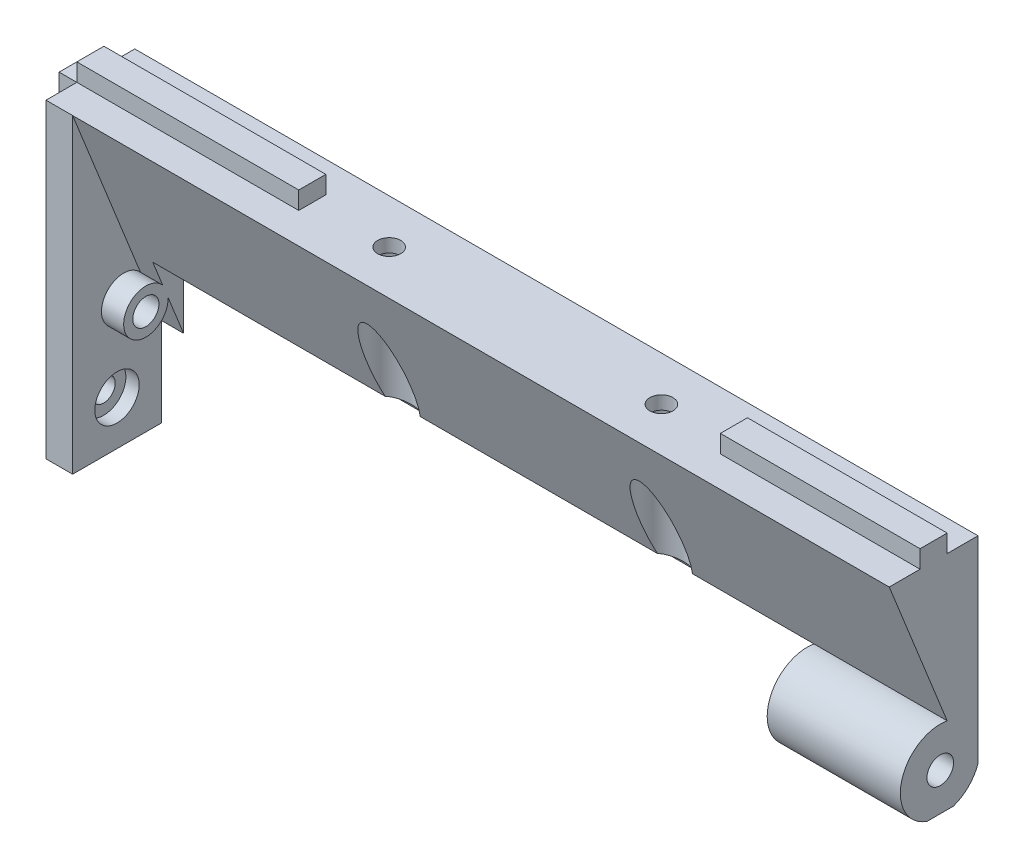
from build123d import *
from build123d.topology import SkipClean

# Parameters (mm, degrees)
SKETCH_1_W           = 120
SKETCH_1_H           = 20
EXTRUDE_1_DEPTH      = 50
SKETCH_2_W           = 6
SKETCH_2_H           = 20
EXTRUDE_2_DEPTH      = 20
CUT_EXTRUDE_1_DEPTH  = 114
SKETCH_4_R           = 2.6
SKETCH_4_W           = 20
SKETCH_4_H           = 20
CUT_EXTRUDE_2_DEPTH  = 114
SKETCH_5_R           = 5
CUT_EXTRUDE_3_DEPTH  = 3
SKETCH_9_R           = 5
SKETCH_9_R_2         = 2.6
EXTRUDE_3_DEPTH      = 3
SKETCH_11_R          = 5
EXTRUDE_4_DEPTH      = 6
CUT_EXTRUDE_6_DEPTH  = 6
CUT_EXTRUDE_8_DEPTH  = 109
SKETCH_14_W          = 20
SKETCH_14_H          = 20
SKETCH_14_R          = 2.6
EXTRUDE_5_DEPTH      = 6
SKETCH_15_R          = 5
CUT_EXTRUDE_9_DEPTH  = 3
SKETCH_18_R          = 5
SKETCH_18_R_2        = 3
EXTRUDE_6_DEPTH      = 5
SKETCH_19_R          = 3
SKETCH_19_R_2        = 2.95
EXTRUDE_7_DEPTH      = 11
EXTRUDE_START        = 70
EXTRUDE_8_DEPTH      = 70
SKETCH_22_W          = 6.1
SKETCH_22_H          = 38.55
EXTRUDE_9_DEPTH      = 4
SKETCH_24_W          = 30
SKETCH_24_H          = 20
EXTRUDE_10_DEPTH     = 50
SKETCH_25_R          = 2.95
CUT_EXTRUDE_10_DEPTH = 200
SKETCH_30_R          = 5
SKETCH_30_R_2        = 2.6
EXTRUDE_11_DEPTH     = 3
SKETCH_32_R          = 3
CUT_EXTRUDE_12_DEPTH = 30
CUT_EXTRUDE_START    = -30
CUT_EXTRUDE_13_DEPTH = 30
SKETCH_35_R          = 5
CUT_EXTRUDE_14_DEPTH = 60
SKETCH_36_R          = 5
SKETCH_36_R_2        = 2.6
EXTRUDE_12_DEPTH     = 3
SKETCH_37_W          = 45
SKETCH_37_H          = 6.104076207
SKETCH_37_W_2        = 50
SKETCH_37_H_2        = 6.1
EXTRUDE_13_DEPTH     = 4


with BuildPart() as part:
    # 草图1 → 凸台-拉伸1 (new body)
    with BuildSketch(Plane(origin=(0, 0, 0), x_dir=(1, 0, 0), z_dir=(0, 1, 0))):
        with Locations((60, 10)):
            Rectangle(SKETCH_1_W, SKETCH_1_H)
    extrude(amount=EXTRUDE_1_DEPTH)

    # 草图2 → 凸台-拉伸2 (add)
    with BuildSketch(Plane.XY):
        with Locations((3, -10)):
            Rectangle(SKETCH_2_W, SKETCH_2_H)
    extrude(amount=-EXTRUDE_2_DEPTH)

    # 草图3 → 切除-拉伸1 (cut)
    with BuildSketch(Plane(origin=(120, 0, 0), x_dir=(0, 0, -1), z_dir=(1, 0, 0))):
        Polygon((0, 50), (20, 0), (0, 0), align=None)
    extrude(amount=-CUT_EXTRUDE_1_DEPTH, mode=Mode.SUBTRACT)

    # 草图4 → 切除-拉伸2 (cut)
    with BuildSketch(Plane(origin=(6, 0, 0), x_dir=(0, 0, -1), z_dir=(1, 0, 0))):
        with Locations((10, 10)):
            Circle(SKETCH_4_R)
        with Locations((10, -10)):
            Rectangle(SKETCH_4_W, SKETCH_4_H)
    extrude(amount=-CUT_EXTRUDE_2_DEPTH, mode=Mode.SUBTRACT)

    # 草图5 → 切除-拉伸3 (cut)
    with BuildSketch(Plane(origin=(6, 0, 0), x_dir=(0, 0, -1), z_dir=(1, 0, 0))):
        with Locations((10, 10)):
            Circle(SKETCH_5_R)
    extrude(amount=-CUT_EXTRUDE_3_DEPTH, mode=Mode.SUBTRACT)

    # 草图9 → 凸台-拉伸3 (add)
    with BuildSketch(Plane(origin=(0, 50, 0), x_dir=(1, 0, 0), z_dir=(0, 1, 0))):
        with Locations((60, 10)):
            Circle(SKETCH_9_R)
        with Locations((60, 10)):
            Circle(SKETCH_9_R_2, mode=Mode.SUBTRACT)
    extrude(amount=-EXTRUDE_3_DEPTH)

    # 草图11 → 凸台-拉伸4 (add)
    with BuildSketch(Plane(origin=(6, 0, 0), x_dir=(0, 0, -1), z_dir=(1, 0, 0))):
        with Locations((10, 10)):
            Circle(SKETCH_11_R)
    extrude(amount=-EXTRUDE_4_DEPTH)

    # 草图12 → 切除-拉伸6 (cut)
    with BuildSketch(Plane.ZY):
        with BuildLine():
            ThreePointArc((-11.5, 5.5), (-9.378679656, 6.378679656), (-8.5, 8.5))
            ThreePointArc((-8.5, 8.5), (-13.621320344, 10.621320344), (-11.5, 5.5))
        make_face()
    extrude(amount=-CUT_EXTRUDE_6_DEPTH, mode=Mode.SUBTRACT)

    # 草图13 → 切除-拉伸8 (cut)
    with BuildSketch(Plane(origin=(120, 0, 0), x_dir=(0, 0, -1), z_dir=(1, 0, 0))):
        with BuildLine():
            Line((20, 0), (20, 11.458039892))
            ThreePointArc((20, 11.458039892), (17.330402546, 15.356121801), (13.054076207, 17.364809481))
            Line((13.054076207, 17.364809481), (20, 0))
        make_face()
    extrude(amount=-CUT_EXTRUDE_8_DEPTH, mode=Mode.SUBTRACT)

    # 草图14 → 凸台-拉伸5 (add)
    with BuildSketch(Plane.ZY):
        with Locations((-10, -10)):
            Rectangle(SKETCH_14_W, SKETCH_14_H)
        with Locations((-10, -10)):
            Circle(SKETCH_14_R, mode=Mode.SUBTRACT)
    extrude(amount=-EXTRUDE_5_DEPTH)

    # 草图15 → 切除-拉伸9 (cut)
    with BuildSketch(Plane(origin=(6, 0, 0), x_dir=(0, 0, -1), z_dir=(1, 0, 0))):
        with Locations((10, -10)):
            Circle(SKETCH_15_R)
    extrude(amount=-CUT_EXTRUDE_9_DEPTH, mode=Mode.SUBTRACT)

    # 草图18 → 凸台-拉伸6 (add)
    with SkipClean():  # the faces are left unmerged after this step: merging them gives an invalid solid
        with BuildSketch(Plane(origin=(6, 0, 0), x_dir=(0, 0, -1), z_dir=(1, 0, 0))):
            with Locations((11.5, 8.5)):
                Circle(SKETCH_18_R)
            with Locations((11.5, 8.5)):
                Circle(SKETCH_18_R_2, mode=Mode.SUBTRACT)
        extrude(amount=EXTRUDE_6_DEPTH)

    # 草图19 → 凸台-拉伸7 (add)
    with BuildSketch(Plane.ZY):
        with Locations((-11.5, 8.5)):
            Circle(SKETCH_19_R)
        with Locations((-11.5, 8.5)):
            Circle(SKETCH_19_R_2, mode=Mode.SUBTRACT)
    extrude(amount=-EXTRUDE_7_DEPTH)

    # 草图20 → 凸台-拉伸8 (add)
    with BuildSketch(Plane(origin=(120, 0, 0), x_dir=(0, 0, -1), z_dir=(1, 0, 0)).offset(EXTRUDE_START)):
        with BuildLine():
            Line((0, 50), (20, 50))
            Line((20, 50), (20, 11.458039892))
            ThreePointArc((20, 11.458039892), (17.330402546, 15.356121801), (13.054076207, 17.364809481))
            Line((13.054076207, 17.364809481), (0, 50))
        make_face()
    extrude(amount=-EXTRUDE_8_DEPTH)

    # 草图22 → 凸台-拉伸9 (add)
    with BuildSketch(Plane.ZY):
        with Locations((-10, 30.725)):
            Rectangle(SKETCH_22_W, SKETCH_22_H)
    extrude(amount=EXTRUDE_9_DEPTH)

    # 草图24 → 凸台-拉伸10 (add)
    with BuildSketch(Plane(origin=(0, 50, 0), x_dir=(1, 0, 0), z_dir=(0, 1, 0))):
        with Locations((175, 10)):
            Rectangle(SKETCH_24_W, SKETCH_24_H)
    extrude(amount=-EXTRUDE_10_DEPTH)

    # 草图25 → 切除-拉伸10 (cut)
    with BuildSketch(Plane.ZY):
        with Locations((-11.5, 8.5)):
            Circle(SKETCH_25_R)
    extrude(amount=-CUT_EXTRUDE_10_DEPTH, mode=Mode.SUBTRACT)

    # 草图30 → 凸台-拉伸11 (add)
    # profile 1 of 2: a face of its own
    with BuildSketch(Plane(origin=(0, 50, 0), x_dir=(1, 0, 0), z_dir=(0, 1, 0))):
        with Locations((57.33, 10)):
            Circle(SKETCH_30_R)
        with Locations((57.33, 10)):
            Circle(SKETCH_30_R_2, mode=Mode.SUBTRACT)
    # profile 2 of 2: a face of its own
    with BuildSketch(Plane(origin=(0, 50, 0), x_dir=(1, 0, 0), z_dir=(0, 1, 0))):
        with Locations((108.67, 10)):
            Circle(SKETCH_30_R)
        with Locations((108.67, 10)):
            Circle(SKETCH_30_R_2, mode=Mode.SUBTRACT)
    extrude(amount=-EXTRUDE_11_DEPTH)

    # 草图32 → 切除-拉伸12 (cut)
    with BuildSketch(Plane(origin=(190, 0, 0), x_dir=(0, 0, -1), z_dir=(1, 0, 0))):
        with Locations((11.5, 8.5)):
            Circle(SKETCH_32_R)
    extrude(amount=-CUT_EXTRUDE_12_DEPTH, mode=Mode.SUBTRACT)

    # 草图34 → 切除-拉伸13 (cut)
    with BuildSketch(Plane.ZY.offset(-160).offset(CUT_EXTRUDE_START)):
        with BuildLine():
            Line((0, 0), (0, 50))
            Line((0, 50), (-13.054076207, 17.364809481))
            ThreePointArc((-13.054076207, 17.364809481), (-2.789263488, 10.763419849), (-8.541960108, 0))
            Line((-8.541960108, 0), (0, 0))
        make_face()
        with BuildLine():
            ThreePointArc((-14.458039892, 0), (-17.863961031, 2.136038969), (-20, 5.541960108))
            Line((-20, 5.541960108), (-20, 0))
            Line((-20, 0), (-14.458039892, 0))
        make_face()
    extrude(amount=CUT_EXTRUDE_13_DEPTH, mode=Mode.SUBTRACT)

    # 草图35 → 切除-拉伸14 (cut)
    with BuildSketch(Plane(origin=(0, 50, 0), x_dir=(1, 0, 0), z_dir=(0, 1, 0))):
        with Locations((128.67, 10)):
            Circle(SKETCH_35_R)
        with Locations((67.33, 10)):
            Circle(SKETCH_35_R)
    extrude(amount=-CUT_EXTRUDE_14_DEPTH, mode=Mode.SUBTRACT)

    # 草图36 → 凸台-拉伸12 (add)
    # profile 1 of 2: a face of its own
    with BuildSketch(Plane(origin=(0, 50, 0), x_dir=(1, 0, 0), z_dir=(0, 1, 0))):
        with Locations((67.33, 10)):
            Circle(SKETCH_36_R)
        with Locations((67.33, 10)):
            Circle(SKETCH_36_R_2, mode=Mode.SUBTRACT)
    # profile 2 of 2: a face of its own
    with BuildSketch(Plane(origin=(0, 50, 0), x_dir=(1, 0, 0), z_dir=(0, 1, 0))):
        with Locations((128.67, 10)):
            Circle(SKETCH_36_R)
        with Locations((128.67, 10)):
            Circle(SKETCH_36_R_2, mode=Mode.SUBTRACT)
    extrude(amount=-EXTRUDE_12_DEPTH)

    # 草图37 → 凸台-拉伸13 (add)
    with BuildSketch(Plane(origin=(0, 50, 0), x_dir=(1, 0, 0), z_dir=(0, 1, 0))):
        with Locations((167.5, 10.002038104)):
            Rectangle(SKETCH_37_W, SKETCH_37_H)
        with Locations((25, 10)):
            Rectangle(SKETCH_37_W_2, SKETCH_37_H_2)
    extrude(amount=EXTRUDE_13_DEPTH)


solid = part.part
